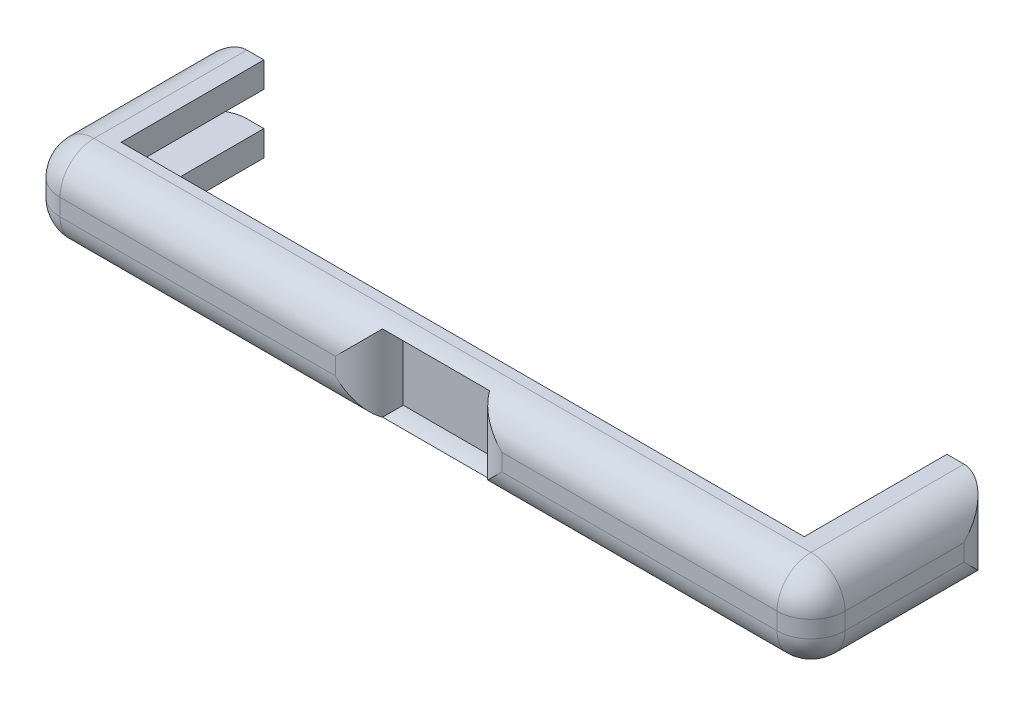
from build123d import *

# Parameters (mm, degrees)
BOSS_EXTRUDE1_DEPTH   = 45
BOSS_EXTRUDE1_2_DEPTH = 45
SKETCH1_3_W           = 231
SKETCH1_3_H           = 25
SKETCH1_3_W_2         = 29
SKETCH1_3_H_2         = 20
BOSS_EXTRUDE2_DEPTH   = 10
BOSS_EXTRUDE3_DEPTH   = 3
FILLET1_R             = 10
FILLET2_R             = 10
FILLET3_R             = 10


with BuildPart() as part:
    # Sketch1 → Boss-Extrude1 (new body)
    with BuildSketch(Plane.XY):
        Polygon((-63.771858253, 3.659087495), (-78.771858253, 3.659087495), (-78.771858253, -21.340912505), (-63.771858253, -21.340912505), (-63.771858253, -13.840912505), (-73.771858253, -13.840912505), (-73.771858253, -3.840912505), (-63.771858253, -3.840912505), align=None)
    extrude(amount=-BOSS_EXTRUDE1_DEPTH)



with BuildPart() as body_2:
    # Sketch1 → Boss-Extrude1 2 (new body)
    with BuildSketch(Plane.XY):
        Polygon((137.228141747, 3.659087495), (137.228141747, -3.840912505), (147.228141747, -3.840912505), (147.228141747, -13.840912505), (137.228141747, -13.840912505), (137.228141747, -21.340912505), (152.228141747, -21.340912505), (152.228141747, 3.659087495), align=None)
    extrude(amount=-BOSS_EXTRUDE1_2_DEPTH)


with BuildPart() as part_1:
    add(part.part)

    add(body_2.part)  # Boss-Extrude2 merges body 2
    # Sketch1<3> → Boss-Extrude2 (add)
    with BuildSketch(Plane.XY):
        with Locations((36.728141747, -8.840912505)):
            Rectangle(SKETCH1_3_W, SKETCH1_3_H)
        with Locations((36.728141747, -8.840912505)):
            Rectangle(SKETCH1_3_W_2, SKETCH1_3_H_2, mode=Mode.SUBTRACT)
    extrude(amount=BOSS_EXTRUDE2_DEPTH)

    # Sketch1<4> → Boss-Extrude3 (add)
    with BuildSketch(Plane.XY):
        Polygon((137.228141747, 3.659087495), (-63.771858253, 3.659087495), (-63.771858253, -3.840912505), (-73.771858253, -3.840912505), (-73.771858253, -13.840912505), (-63.771858253, -13.840912505), (-63.771858253, -21.340912505), (137.228141747, -21.340912505), (137.228141747, -13.840912505), (147.228141747, -13.840912505), (147.228141747, -3.840912505), (137.228141747, -3.840912505), align=None)
    extrude(amount=-BOSS_EXTRUDE3_DEPTH)

    # Fillet1
    # the kernel refuses this fillet: 10 mm, written as the material it takes off along each edge
    with BuildSketch(Plane(origin=(22.228141747, 1.159087495, 10), x_dir=(0, 1, 0), z_dir=(1, 0, 0)), Plane(origin=(51.228141747, -18.840912505, 10), x_dir=(0, -1, 0), z_dir=(-1, 0, 0))) as fillet1_piece_1:
        with BuildLine():
            CenterArc((FILLET1_R, -FILLET1_R), FILLET1_R, 90, 90)
            Line((0, -FILLET1_R), (-FILLET1_R * 0.02, -FILLET1_R))
            Line((-FILLET1_R * 0.02, -FILLET1_R), (-FILLET1_R * 0.02, FILLET1_R * 0.02))
            Line((-FILLET1_R * 0.02, FILLET1_R * 0.02), (FILLET1_R, FILLET1_R * 0.02))
            Line((FILLET1_R, FILLET1_R * 0.02), (FILLET1_R, 0))
        make_face()
    extrude(amount=29, mode=Mode.SUBTRACT)
    with BuildSketch(Plane(origin=(22.228141747, -18.840912505, 10), x_dir=(-1, 0, 0), z_dir=(0, 1, 0)), Plane(origin=(51.228141747, 1.159087495, 10), x_dir=(1, 0, 0), z_dir=(0, -1, 0))) as fillet1_piece_2:
        with BuildLine():
            CenterArc((FILLET1_R, -FILLET1_R), FILLET1_R, 90, 90)
            Line((0, -FILLET1_R), (-FILLET1_R * 0.02, -FILLET1_R))
            Line((-FILLET1_R * 0.02, -FILLET1_R), (-FILLET1_R * 0.02, FILLET1_R * 0.02))
            Line((-FILLET1_R * 0.02, FILLET1_R * 0.02), (FILLET1_R, FILLET1_R * 0.02))
            Line((FILLET1_R, FILLET1_R * 0.02), (FILLET1_R, 0))
        make_face()
    extrude(amount=20, mode=Mode.SUBTRACT)
    with BuildSketch(Plane(origin=(-78.771858253, 3.659087495, 10), x_dir=(0, 0, -1), z_dir=(0, -1, 0))) as fillet1_piece_3:
        with BuildLine():
            CenterArc((FILLET1_R, FILLET1_R), FILLET1_R, 180, 90)
            Line((0, FILLET1_R), (-FILLET1_R * 0.02, FILLET1_R))
            Line((-FILLET1_R * 0.02, FILLET1_R), (-FILLET1_R * 0.02, -FILLET1_R * 0.02))
            Line((-FILLET1_R * 0.02, -FILLET1_R * 0.02), (FILLET1_R, -FILLET1_R * 0.02))
            Line((FILLET1_R, -FILLET1_R * 0.02), (FILLET1_R, 0))
        make_face()
    extrude(amount=25, mode=Mode.SUBTRACT)
    with BuildSketch(Plane(origin=(152.228141747, 3.659087495, 10), x_dir=(0, 0, -1), z_dir=(-1, 0, 0)), Plane(origin=(-78.771858253, -21.340912505, 10), x_dir=(0, 0, -1), z_dir=(1, 0, 0))) as fillet1_piece_4:
        with BuildLine():
            CenterArc((FILLET1_R, FILLET1_R), FILLET1_R, 180, 90)
            Line((0, FILLET1_R), (-FILLET1_R * 0.02, FILLET1_R))
            Line((-FILLET1_R * 0.02, FILLET1_R), (-FILLET1_R * 0.02, -FILLET1_R * 0.02))
            Line((-FILLET1_R * 0.02, -FILLET1_R * 0.02), (FILLET1_R, -FILLET1_R * 0.02))
            Line((FILLET1_R, -FILLET1_R * 0.02), (FILLET1_R, 0))
        make_face()
    extrude(amount=231, mode=Mode.SUBTRACT)
    with BuildSketch(Plane(origin=(152.228141747, -21.340912505, 10), x_dir=(-1, 0, 0), z_dir=(0, 1, 0))) as fillet1_piece_5:
        with BuildLine():
            CenterArc((FILLET1_R, -FILLET1_R), FILLET1_R, 90, 90)
            Line((0, -FILLET1_R), (-FILLET1_R * 0.02, -FILLET1_R))
            Line((-FILLET1_R * 0.02, -FILLET1_R), (-FILLET1_R * 0.02, FILLET1_R * 0.02))
            Line((-FILLET1_R * 0.02, FILLET1_R * 0.02), (FILLET1_R, FILLET1_R * 0.02))
            Line((FILLET1_R, FILLET1_R * 0.02), (FILLET1_R, 0))
        make_face()
    extrude(amount=25, mode=Mode.SUBTRACT)
    with BuildSketch(Plane(origin=(22.228141747, -18.840912505, 10), x_dir=(-1, 0, 0), z_dir=(0, 1, 0))) as fillet1_piece_6a_section:
        with BuildLine():
            CenterArc((FILLET1_R, -FILLET1_R), FILLET1_R, 90, 90)
            Line((0, -FILLET1_R), (-FILLET1_R * 0.02, -FILLET1_R))
            Line((-FILLET1_R * 0.02, -FILLET1_R), (-FILLET1_R * 0.02, FILLET1_R * 0.02))
            Line((-FILLET1_R * 0.02, FILLET1_R * 0.02), (FILLET1_R, FILLET1_R * 0.02))
            Line((FILLET1_R, FILLET1_R * 0.02), (FILLET1_R, 0))
        make_face()
    fillet1_piece_6a = extrude(amount=45, mode=Mode.PRIVATE)
    fillet1_piece_6a = split(fillet1_piece_6a, bisect_by=Plane(origin=(19.964190605, 1.159087495, 7.736048857), z_dir=(0, 1, 0)), keep=Keep.TOP, mode=Mode.PRIVATE)
    with BuildSketch(Plane(origin=(-2.771858253, 1.159087495, 10), x_dir=(0, 1, 0), z_dir=(1, 0, 0))) as fillet1_piece_6b_section:
        with BuildLine():
            CenterArc((FILLET1_R, -FILLET1_R), FILLET1_R, 90, 90)
            Line((0, -FILLET1_R), (-FILLET1_R * 0.02, -FILLET1_R))
            Line((-FILLET1_R * 0.02, -FILLET1_R), (-FILLET1_R * 0.02, FILLET1_R * 0.02))
            Line((-FILLET1_R * 0.02, FILLET1_R * 0.02), (FILLET1_R, FILLET1_R * 0.02))
            Line((FILLET1_R, FILLET1_R * 0.02), (FILLET1_R, 0))
        make_face()
    fillet1_piece_6b = extrude(amount=54, mode=Mode.PRIVATE)
    fillet1_piece_6b = split(fillet1_piece_6b, bisect_by=Plane(origin=(22.228141747, 3.423038638, 7.736048857), z_dir=(-1, 0, 0)), keep=Keep.TOP, mode=Mode.PRIVATE)
    fillet1_piece_6 = fillet1_piece_6a & fillet1_piece_6b
    add(fillet1_piece_6, mode=Mode.SUBTRACT)
    with BuildSketch(Plane(origin=(22.228141747, 1.159087495, 10), x_dir=(0, 1, 0), z_dir=(1, 0, 0))) as fillet1_piece_7a_section:
        with BuildLine():
            CenterArc((FILLET1_R, -FILLET1_R), FILLET1_R, 90, 90)
            Line((0, -FILLET1_R), (-FILLET1_R * 0.02, -FILLET1_R))
            Line((-FILLET1_R * 0.02, -FILLET1_R), (-FILLET1_R * 0.02, FILLET1_R * 0.02))
            Line((-FILLET1_R * 0.02, FILLET1_R * 0.02), (FILLET1_R, FILLET1_R * 0.02))
            Line((FILLET1_R, FILLET1_R * 0.02), (FILLET1_R, 0))
        make_face()
    fillet1_piece_7a = extrude(amount=54, mode=Mode.PRIVATE)
    fillet1_piece_7a = split(fillet1_piece_7a, bisect_by=Plane(origin=(51.228141747, 3.423038638, 7.736048857), z_dir=(1, 0, 0)), keep=Keep.TOP, mode=Mode.PRIVATE)
    with BuildSketch(Plane(origin=(51.228141747, 26.159087495, 10), x_dir=(1, 0, 0), z_dir=(0, -1, 0))) as fillet1_piece_7b_section:
        with BuildLine():
            CenterArc((FILLET1_R, -FILLET1_R), FILLET1_R, 90, 90)
            Line((0, -FILLET1_R), (-FILLET1_R * 0.02, -FILLET1_R))
            Line((-FILLET1_R * 0.02, -FILLET1_R), (-FILLET1_R * 0.02, FILLET1_R * 0.02))
            Line((-FILLET1_R * 0.02, FILLET1_R * 0.02), (FILLET1_R, FILLET1_R * 0.02))
            Line((FILLET1_R, FILLET1_R * 0.02), (FILLET1_R, 0))
        make_face()
    fillet1_piece_7b = extrude(amount=45, mode=Mode.PRIVATE)
    fillet1_piece_7b = split(fillet1_piece_7b, bisect_by=Plane(origin=(53.49209289, 1.159087495, 7.736048857), z_dir=(0, 1, 0)), keep=Keep.TOP, mode=Mode.PRIVATE)
    fillet1_piece_7 = fillet1_piece_7a & fillet1_piece_7b
    add(fillet1_piece_7, mode=Mode.SUBTRACT)
    with BuildSketch(Plane(origin=(51.228141747, -18.840912505, 10), x_dir=(0, -1, 0), z_dir=(-1, 0, 0))) as fillet1_piece_8a_section:
        with BuildLine():
            CenterArc((FILLET1_R, -FILLET1_R), FILLET1_R, 90, 90)
            Line((0, -FILLET1_R), (-FILLET1_R * 0.02, -FILLET1_R))
            Line((-FILLET1_R * 0.02, -FILLET1_R), (-FILLET1_R * 0.02, FILLET1_R * 0.02))
            Line((-FILLET1_R * 0.02, FILLET1_R * 0.02), (FILLET1_R, FILLET1_R * 0.02))
            Line((FILLET1_R, FILLET1_R * 0.02), (FILLET1_R, 0))
        make_face()
    fillet1_piece_8a = extrude(amount=54, mode=Mode.PRIVATE)
    fillet1_piece_8a = split(fillet1_piece_8a, bisect_by=Plane(origin=(22.228141747, -21.104863647, 7.736048857), z_dir=(-1, 0, 0)), keep=Keep.TOP, mode=Mode.PRIVATE)
    with BuildSketch(Plane(origin=(22.228141747, -43.840912505, 10), x_dir=(-1, 0, 0), z_dir=(0, 1, 0))) as fillet1_piece_8b_section:
        with BuildLine():
            CenterArc((FILLET1_R, -FILLET1_R), FILLET1_R, 90, 90)
            Line((0, -FILLET1_R), (-FILLET1_R * 0.02, -FILLET1_R))
            Line((-FILLET1_R * 0.02, -FILLET1_R), (-FILLET1_R * 0.02, FILLET1_R * 0.02))
            Line((-FILLET1_R * 0.02, FILLET1_R * 0.02), (FILLET1_R, FILLET1_R * 0.02))
            Line((FILLET1_R, FILLET1_R * 0.02), (FILLET1_R, 0))
        make_face()
    fillet1_piece_8b = extrude(amount=45, mode=Mode.PRIVATE)
    fillet1_piece_8b = split(fillet1_piece_8b, bisect_by=Plane(origin=(19.964190605, -18.840912505, 7.736048857), z_dir=(0, -1, 0)), keep=Keep.TOP, mode=Mode.PRIVATE)
    fillet1_piece_8 = fillet1_piece_8a & fillet1_piece_8b
    add(fillet1_piece_8, mode=Mode.SUBTRACT)
    with BuildSketch(Plane(origin=(76.228141747, -18.840912505, 10), x_dir=(0, -1, 0), z_dir=(-1, 0, 0))) as fillet1_piece_9a_section:
        with BuildLine():
            CenterArc((FILLET1_R, -FILLET1_R), FILLET1_R, 90, 90)
            Line((0, -FILLET1_R), (-FILLET1_R * 0.02, -FILLET1_R))
            Line((-FILLET1_R * 0.02, -FILLET1_R), (-FILLET1_R * 0.02, FILLET1_R * 0.02))
            Line((-FILLET1_R * 0.02, FILLET1_R * 0.02), (FILLET1_R, FILLET1_R * 0.02))
            Line((FILLET1_R, FILLET1_R * 0.02), (FILLET1_R, 0))
        make_face()
    fillet1_piece_9a = extrude(amount=54, mode=Mode.PRIVATE)
    fillet1_piece_9a = split(fillet1_piece_9a, bisect_by=Plane(origin=(51.228141747, -21.104863647, 7.736048857), z_dir=(1, 0, 0)), keep=Keep.TOP, mode=Mode.PRIVATE)
    with BuildSketch(Plane(origin=(51.228141747, 1.159087495, 10), x_dir=(1, 0, 0), z_dir=(0, -1, 0))) as fillet1_piece_9b_section:
        with BuildLine():
            CenterArc((FILLET1_R, -FILLET1_R), FILLET1_R, 90, 90)
            Line((0, -FILLET1_R), (-FILLET1_R * 0.02, -FILLET1_R))
            Line((-FILLET1_R * 0.02, -FILLET1_R), (-FILLET1_R * 0.02, FILLET1_R * 0.02))
            Line((-FILLET1_R * 0.02, FILLET1_R * 0.02), (FILLET1_R, FILLET1_R * 0.02))
            Line((FILLET1_R, FILLET1_R * 0.02), (FILLET1_R, 0))
        make_face()
    fillet1_piece_9b = extrude(amount=45, mode=Mode.PRIVATE)
    fillet1_piece_9b = split(fillet1_piece_9b, bisect_by=Plane(origin=(53.49209289, -18.840912505, 7.736048857), z_dir=(0, -1, 0)), keep=Keep.TOP, mode=Mode.PRIVATE)
    fillet1_piece_9 = fillet1_piece_9a & fillet1_piece_9b
    add(fillet1_piece_9, mode=Mode.SUBTRACT)
    with BuildSketch(Plane(origin=(152.228141747, 3.659087495, 10), x_dir=(0, 0, -1), z_dir=(-1, 0, 0))) as fillet1_piece_10a_section:
        with BuildLine():
            CenterArc((FILLET1_R, FILLET1_R), FILLET1_R, 180, 90)
            Line((0, FILLET1_R), (-FILLET1_R * 0.02, FILLET1_R))
            Line((-FILLET1_R * 0.02, FILLET1_R), (-FILLET1_R * 0.02, -FILLET1_R * 0.02))
            Line((-FILLET1_R * 0.02, -FILLET1_R * 0.02), (FILLET1_R, -FILLET1_R * 0.02))
            Line((FILLET1_R, -FILLET1_R * 0.02), (FILLET1_R, 0))
        make_face()
    fillet1_piece_10a = extrude(amount=256, mode=Mode.PRIVATE)
    fillet1_piece_10a = split(fillet1_piece_10a, bisect_by=Plane(origin=(-78.771858253, 1.395136353, 7.736048857), z_dir=(-1, 0, 0)), keep=Keep.TOP, mode=Mode.PRIVATE)
    with BuildSketch(Plane(origin=(-78.771858253, 28.659087495, 10), x_dir=(0, 0, -1), z_dir=(0, -1, 0))) as fillet1_piece_10b_section:
        with BuildLine():
            CenterArc((FILLET1_R, FILLET1_R), FILLET1_R, 180, 90)
            Line((0, FILLET1_R), (-FILLET1_R * 0.02, FILLET1_R))
            Line((-FILLET1_R * 0.02, FILLET1_R), (-FILLET1_R * 0.02, -FILLET1_R * 0.02))
            Line((-FILLET1_R * 0.02, -FILLET1_R * 0.02), (FILLET1_R, -FILLET1_R * 0.02))
            Line((FILLET1_R, -FILLET1_R * 0.02), (FILLET1_R, 0))
        make_face()
    fillet1_piece_10b = extrude(amount=50, mode=Mode.PRIVATE)
    fillet1_piece_10b = split(fillet1_piece_10b, bisect_by=Plane(origin=(-76.50790711, 3.659087495, 7.736048857), z_dir=(0, 1, 0)), keep=Keep.TOP, mode=Mode.PRIVATE)
    fillet1_piece_10 = fillet1_piece_10a & fillet1_piece_10b
    add(fillet1_piece_10, mode=Mode.SUBTRACT)
    with BuildSketch(Plane(origin=(-103.771858253, -21.340912505, 10), x_dir=(0, 0, -1), z_dir=(1, 0, 0))) as fillet1_piece_11a_section:
        with BuildLine():
            CenterArc((FILLET1_R, FILLET1_R), FILLET1_R, 180, 90)
            Line((0, FILLET1_R), (-FILLET1_R * 0.02, FILLET1_R))
            Line((-FILLET1_R * 0.02, FILLET1_R), (-FILLET1_R * 0.02, -FILLET1_R * 0.02))
            Line((-FILLET1_R * 0.02, -FILLET1_R * 0.02), (FILLET1_R, -FILLET1_R * 0.02))
            Line((FILLET1_R, -FILLET1_R * 0.02), (FILLET1_R, 0))
        make_face()
    fillet1_piece_11a = extrude(amount=256, mode=Mode.PRIVATE)
    fillet1_piece_11a = split(fillet1_piece_11a, bisect_by=Plane(origin=(-78.771858253, -19.076961362, 7.736048857), z_dir=(-1, 0, 0)), keep=Keep.TOP, mode=Mode.PRIVATE)
    with BuildSketch(Plane(origin=(-78.771858253, 3.659087495, 10), x_dir=(0, 0, -1), z_dir=(0, -1, 0))) as fillet1_piece_11b_section:
        with BuildLine():
            CenterArc((FILLET1_R, FILLET1_R), FILLET1_R, 180, 90)
            Line((0, FILLET1_R), (-FILLET1_R * 0.02, FILLET1_R))
            Line((-FILLET1_R * 0.02, FILLET1_R), (-FILLET1_R * 0.02, -FILLET1_R * 0.02))
            Line((-FILLET1_R * 0.02, -FILLET1_R * 0.02), (FILLET1_R, -FILLET1_R * 0.02))
            Line((FILLET1_R, -FILLET1_R * 0.02), (FILLET1_R, 0))
        make_face()
    fillet1_piece_11b = extrude(amount=50, mode=Mode.PRIVATE)
    fillet1_piece_11b = split(fillet1_piece_11b, bisect_by=Plane(origin=(-76.50790711, -21.340912505, 7.736048857), z_dir=(0, -1, 0)), keep=Keep.TOP, mode=Mode.PRIVATE)
    fillet1_piece_11 = fillet1_piece_11a & fillet1_piece_11b
    add(fillet1_piece_11, mode=Mode.SUBTRACT)
    with BuildSketch(Plane(origin=(177.228141747, 3.659087495, 10), x_dir=(0, 0, -1), z_dir=(-1, 0, 0))) as fillet1_piece_12a_section:
        with BuildLine():
            CenterArc((FILLET1_R, FILLET1_R), FILLET1_R, 180, 90)
            Line((0, FILLET1_R), (-FILLET1_R * 0.02, FILLET1_R))
            Line((-FILLET1_R * 0.02, FILLET1_R), (-FILLET1_R * 0.02, -FILLET1_R * 0.02))
            Line((-FILLET1_R * 0.02, -FILLET1_R * 0.02), (FILLET1_R, -FILLET1_R * 0.02))
            Line((FILLET1_R, -FILLET1_R * 0.02), (FILLET1_R, 0))
        make_face()
    fillet1_piece_12a = extrude(amount=256, mode=Mode.PRIVATE)
    fillet1_piece_12a = split(fillet1_piece_12a, bisect_by=Plane(origin=(152.228141747, 1.395136353, 7.736048857), z_dir=(1, 0, 0)), keep=Keep.TOP, mode=Mode.PRIVATE)
    with BuildSketch(Plane(origin=(152.228141747, -21.340912505, 10), x_dir=(-1, 0, 0), z_dir=(0, 1, 0))) as fillet1_piece_12b_section:
        with BuildLine():
            CenterArc((FILLET1_R, -FILLET1_R), FILLET1_R, 90, 90)
            Line((0, -FILLET1_R), (-FILLET1_R * 0.02, -FILLET1_R))
            Line((-FILLET1_R * 0.02, -FILLET1_R), (-FILLET1_R * 0.02, FILLET1_R * 0.02))
            Line((-FILLET1_R * 0.02, FILLET1_R * 0.02), (FILLET1_R, FILLET1_R * 0.02))
            Line((FILLET1_R, FILLET1_R * 0.02), (FILLET1_R, 0))
        make_face()
    fillet1_piece_12b = extrude(amount=50, mode=Mode.PRIVATE)
    fillet1_piece_12b = split(fillet1_piece_12b, bisect_by=Plane(origin=(149.964190605, 3.659087495, 7.736048857), z_dir=(0, 1, 0)), keep=Keep.TOP, mode=Mode.PRIVATE)
    fillet1_piece_12 = fillet1_piece_12a & fillet1_piece_12b
    add(fillet1_piece_12, mode=Mode.SUBTRACT)
    with BuildSketch(Plane(origin=(-78.771858253, -21.340912505, 10), x_dir=(0, 0, -1), z_dir=(1, 0, 0))) as fillet1_piece_13a_section:
        with BuildLine():
            CenterArc((FILLET1_R, FILLET1_R), FILLET1_R, 180, 90)
            Line((0, FILLET1_R), (-FILLET1_R * 0.02, FILLET1_R))
            Line((-FILLET1_R * 0.02, FILLET1_R), (-FILLET1_R * 0.02, -FILLET1_R * 0.02))
            Line((-FILLET1_R * 0.02, -FILLET1_R * 0.02), (FILLET1_R, -FILLET1_R * 0.02))
            Line((FILLET1_R, -FILLET1_R * 0.02), (FILLET1_R, 0))
        make_face()
    fillet1_piece_13a = extrude(amount=256, mode=Mode.PRIVATE)
    fillet1_piece_13a = split(fillet1_piece_13a, bisect_by=Plane(origin=(152.228141747, -19.076961362, 7.736048857), z_dir=(1, 0, 0)), keep=Keep.TOP, mode=Mode.PRIVATE)
    with BuildSketch(Plane(origin=(152.228141747, -46.340912505, 10), x_dir=(-1, 0, 0), z_dir=(0, 1, 0))) as fillet1_piece_13b_section:
        with BuildLine():
            CenterArc((FILLET1_R, -FILLET1_R), FILLET1_R, 90, 90)
            Line((0, -FILLET1_R), (-FILLET1_R * 0.02, -FILLET1_R))
            Line((-FILLET1_R * 0.02, -FILLET1_R), (-FILLET1_R * 0.02, FILLET1_R * 0.02))
            Line((-FILLET1_R * 0.02, FILLET1_R * 0.02), (FILLET1_R, FILLET1_R * 0.02))
            Line((FILLET1_R, FILLET1_R * 0.02), (FILLET1_R, 0))
        make_face()
    fillet1_piece_13b = extrude(amount=50, mode=Mode.PRIVATE)
    fillet1_piece_13b = split(fillet1_piece_13b, bisect_by=Plane(origin=(149.964190605, -21.340912505, 7.736048857), z_dir=(0, -1, 0)), keep=Keep.TOP, mode=Mode.PRIVATE)
    fillet1_piece_13 = fillet1_piece_13a & fillet1_piece_13b
    add(fillet1_piece_13, mode=Mode.SUBTRACT)

    # Fillet2
    # the kernel refuses this fillet: 10 mm, written as the material it takes off along each edge
    with BuildSketch(Plane(origin=(142.228141747, -11.340912505, 0), x_dir=(1, 0, 0), z_dir=(0, -1, 0))) as fillet2_piece_1_section:
        Polygon((0, 0), (FILLET2_R, 0), (FILLET2_R, FILLET2_R), (0, FILLET2_R), align=None)
    fillet2_piece_1 = extrude(amount=FILLET2_R, mode=Mode.PRIVATE)
    fillet2_piece_1 = fillet2_piece_1 - Plane(origin=(142.228141747, -11.340912505, 0), x_dir=(-0.7071067811865475, 0, -0.7071067811865475), z_dir=(0, -1, 0)) * Sphere(FILLET2_R, mode=Mode.PRIVATE)
    add(fillet2_piece_1, mode=Mode.SUBTRACT)
    with BuildSketch(Plane(origin=(142.228141747, -6.340912505, 0), x_dir=(1, 0, 0), z_dir=(0, 1, 0))) as fillet2_piece_2_section:
        Polygon((0, 0), (FILLET2_R, 0), (FILLET2_R, -FILLET2_R), (0, -FILLET2_R), align=None)
    fillet2_piece_2 = extrude(amount=FILLET2_R, mode=Mode.PRIVATE)
    fillet2_piece_2 = fillet2_piece_2 - Plane(origin=(142.228141747, -6.340912505, 0), x_dir=(-0.7071067811865475, 0, -0.7071067811865475), z_dir=(0, 1, 0)) * Sphere(FILLET2_R, mode=Mode.PRIVATE)
    add(fillet2_piece_2, mode=Mode.SUBTRACT)
    with BuildSketch(Plane(origin=(152.228141747, -46.340912505, -45), x_dir=(-1, 0, 0), z_dir=(0, 1, 0))) as fillet2_piece_3:
        with BuildLine():
            CenterArc((FILLET2_R, FILLET2_R), FILLET2_R, 180, 90)
            Line((0, FILLET2_R), (0, 0))
            Line((0, 0), (FILLET2_R, 0))
        make_face()
    extrude(amount=75, mode=Mode.SUBTRACT)
    with BuildSketch(Plane(origin=(152.228141747, -21.340912505, -70), x_dir=(-1, 0, 0), z_dir=(0, 0, 1)), Plane(origin=(152.228141747, 3.659087495, 0), x_dir=(-1, 0, 0), z_dir=(0, 0, -1))) as fillet2_piece_4:
        with BuildLine():
            CenterArc((FILLET2_R, -FILLET2_R), FILLET2_R, 90, 90)
            Line((0, -FILLET2_R), (0, 0))
            Line((0, 0), (FILLET2_R, 0))
        make_face()
    extrude(amount=70, mode=Mode.SUBTRACT)

    # Fillet3
    # the kernel refuses this fillet: 10 mm, written as the material it takes off along each edge
    with BuildSketch(Plane(origin=(-68.771858253, -6.340912505, 0), x_dir=(-1, 0, 0), z_dir=(0, 1, 0))) as fillet3_piece_1_section:
        Polygon((0, 0), (FILLET3_R, 0), (FILLET3_R, FILLET3_R), (0, FILLET3_R), align=None)
    fillet3_piece_1 = extrude(amount=FILLET3_R, mode=Mode.PRIVATE)
    fillet3_piece_1 = fillet3_piece_1 - Plane(origin=(-68.771858253, -6.340912505, 0), x_dir=(0.7071067811865475, 0, -0.7071067811865475), z_dir=(0, 1, 0)) * Sphere(FILLET3_R, mode=Mode.PRIVATE)
    add(fillet3_piece_1, mode=Mode.SUBTRACT)
    with BuildSketch(Plane(origin=(-68.771858253, -11.340912505, 0), x_dir=(-1, 0, 0), z_dir=(0, -1, 0))) as fillet3_piece_2_section:
        Polygon((0, 0), (FILLET3_R, 0), (FILLET3_R, -FILLET3_R), (0, -FILLET3_R), align=None)
    fillet3_piece_2 = extrude(amount=FILLET3_R, mode=Mode.PRIVATE)
    fillet3_piece_2 = fillet3_piece_2 - Plane(origin=(-68.771858253, -11.340912505, 0), x_dir=(0.7071067811865475, 0, -0.7071067811865475), z_dir=(0, -1, 0)) * Sphere(FILLET3_R, mode=Mode.PRIVATE)
    add(fillet3_piece_2, mode=Mode.SUBTRACT)
    with BuildSketch(Plane(origin=(-78.771858253, -21.340912505, 0), x_dir=(1, 0, 0), z_dir=(0, 0, -1)), Plane(origin=(-78.771858253, 3.659087495, -70), x_dir=(1, 0, 0), z_dir=(0, 0, 1))) as fillet3_piece_3:
        with BuildLine():
            CenterArc((FILLET3_R, -FILLET3_R), FILLET3_R, 90, 90)
            Line((0, -FILLET3_R), (0, 0))
            Line((0, 0), (FILLET3_R, 0))
        make_face()
    extrude(amount=70, mode=Mode.SUBTRACT)
    with BuildSketch(Plane(origin=(-78.771858253, 28.659087495, -45), x_dir=(1, 0, 0), z_dir=(0, -1, 0))) as fillet3_piece_4:
        with BuildLine():
            CenterArc((FILLET3_R, FILLET3_R), FILLET3_R, 180, 90)
            Line((0, FILLET3_R), (0, 0))
            Line((0, 0), (FILLET3_R, 0))
        make_face()
    extrude(amount=75, mode=Mode.SUBTRACT)


solid = part_1.part
